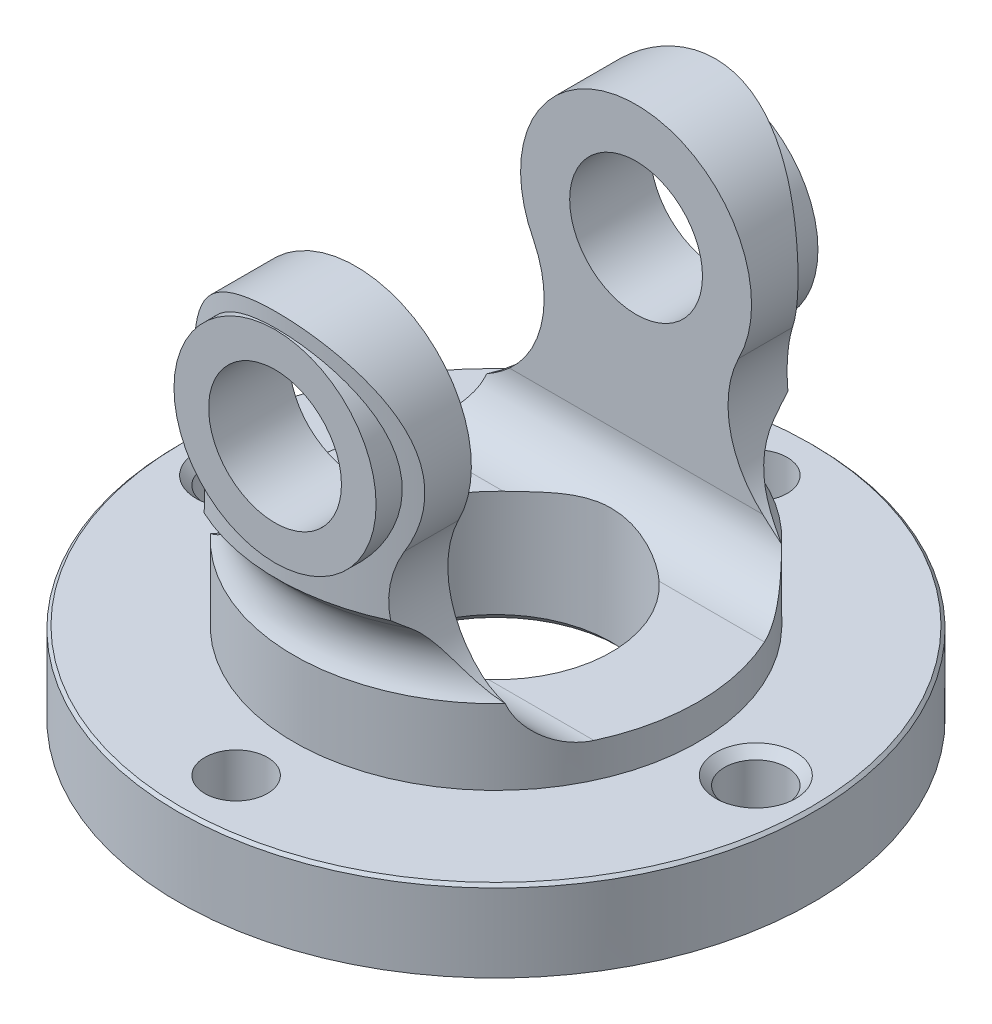
from build123d import *

# Parameters (mm, degrees)
CUT_EXTRUDE3_DEPTH      = 112.579568022
CUT_EXTRUDE3_DEPTH_BACK = 112.579568022
SKETCH2_W               = 15
SKETCH2_H               = 48
CUT_EXTRUDE4_DEPTH      = 112.579568022
CUT_EXTRUDE4_DEPTH_BACK = 112.579568022
SKETCH3_W               = 48.522720568
SKETCH3_H               = 48
FILLET1_R               = 8
DELETEFACE1_START       = 26.9999999
DELETEFACE1_DEPTH       = 53.0000001
SKETCH4_R               = 17.5
SKETCH4_R_2             = 11.5
BOSS_EXTRUDE1_DEPTH     = 14
CUT_EXTRUDE5_DEPTH      = 112.579568094
CUT_EXTRUDE5_DEPTH_BACK = 112.579568094
SKETCH5_R               = 11.5
FILLET3_R               = 20
CUT_EXTRUDE6_DEPTH      = 103.009803515
CUT_EXTRUDE6_DEPTH_BACK = 103.009803515
SKETCH8_R               = 5.425
CHAMFER1_SIZE           = 1.5
CHAMFER2_SIZE           = 0.5
CUT_EXTRUDE7_DEPTH      = 112.579568094
CUT_EXTRUDE7_DEPTH_BACK = 112.579568094
CUT_EXTRUDE8_DEPTH      = 112.579568094
CUT_EXTRUDE8_DEPTH_BACK = 112.579568094


with BuildPart() as part:
    # Sketch1 → Revolve1 (revolve)
    with BuildSketch(Plane.XY, mode=Mode.PRIVATE) as revolve1_sk:
        Polygon((20, 0), (55, 0), (55, 14), (35, 14), (35, 27), (30, 32), (38, 40), (38, 80), (30, 80), (30, 40), (20, 30), (20, 14), align=None)
    revolve(revolve1_sk.sketch.rotate(Axis((0, 0, 0), (0, 1, 0)), 90), axis=Axis((0, 0, 0), (0, 1, 0)))

    # Sketch2 → Cut-Extrude3 (cut, two sides: drawn at the far end of the back side and taken through both)
    with BuildSketch(Plane.XY.offset(-CUT_EXTRUDE3_DEPTH_BACK)):
        with Locations((-30.5, 56)):
            Rectangle(SKETCH2_W, SKETCH2_H)
        with Locations((30.5, 56)):
            Rectangle(SKETCH2_W, SKETCH2_H)
    extrude(amount=CUT_EXTRUDE3_DEPTH + CUT_EXTRUDE3_DEPTH_BACK, mode=Mode.SUBTRACT)

    # Sketch3 → Cut-Extrude4 (cut, two sides: drawn at the far end of the back side and taken through both)
    with BuildSketch(Plane(origin=(0, 0, 0), x_dir=(0, 0, -1), z_dir=(1, 0, 0)).offset(-CUT_EXTRUDE4_DEPTH_BACK)):
        with Locations((0, 56)):
            Rectangle(SKETCH3_W, SKETCH3_H)
    extrude(amount=CUT_EXTRUDE4_DEPTH + CUT_EXTRUDE4_DEPTH_BACK, mode=Mode.SUBTRACT)

    # Fillet1
    # the kernel refuses this fillet: 8 mm, written as the material it adds along each edge
    with BuildSketch(Plane(origin=(0, 32, 0), x_dir=(-0.961157197815047, 0, 0.2760015237065304), z_dir=(-0.2760015237065304, 0, -0.961157197815047))) as fillet1_piece_1_section:
        with BuildLine():
            CenterArc((41.275443262, -0.038265237), FILLET1_R, 135, 83.331971404)
            Line((35.618589013, 5.618589013), (30, 0))
            Line((30, 0), (35, -5))
        make_face()
    fillet1_piece_1 = revolve(axis=Axis((0, 32, 0), (0, 1, 0)), revolution_arc=147.956585356, mode=Mode.PRIVATE)
    fillet1_piece_1 = split(fillet1_piece_1, bisect_by=Plane(origin=(0, 32, 24.261360284), z_dir=(0, 0, 1)), keep=Keep.TOP, mode=Mode.PRIVATE)
    fillet1_piece_1 = split(fillet1_piece_1, bisect_by=Plane(origin=(0, 32, 0), z_dir=(0, -1, 0)), keep=Keep.TOP, mode=Mode.PRIVATE)
    add(fillet1_piece_1)
    with BuildSketch(Plane(origin=(0, 32, 0), x_dir=(-0.961157197815047, 0, 0.2760015237065304), z_dir=(-0.2760015237065304, 0, -0.961157197815047))) as fillet1_piece_2_section:
        with BuildLine():
            CenterArc((41.275443262, -0.038265237), FILLET1_R, 135, 83.331971404)
            Line((35.618589013, 5.618589013), (30, 0))
            Line((30, 0), (35, -5))
        make_face()
    fillet1_piece_2 = revolve(axis=Axis((0, 32, 0), (0, 1, 0)), revolution_arc=147.956585356, mode=Mode.PRIVATE)
    fillet1_piece_2 = split(fillet1_piece_2, bisect_by=Plane(origin=(-23, 32, 0), z_dir=(1, 0, 0)), keep=Keep.TOP, mode=Mode.PRIVATE)
    fillet1_piece_2 = split(fillet1_piece_2, bisect_by=Plane(origin=(0, 32, 24.261360284), z_dir=(0, 0, 1)), keep=Keep.TOP, mode=Mode.PRIVATE)
    fillet1_piece_2 = split(fillet1_piece_2, bisect_by=Plane(origin=(23, 32, 0), z_dir=(-1, 0, 0)), keep=Keep.TOP, mode=Mode.PRIVATE)
    add(fillet1_piece_2)
    with BuildSketch(Plane(origin=(0, 32, 0), x_dir=(0, 0, -1), z_dir=(1, 0, 0))) as fillet1_piece_3_section:
        with BuildLine():
            CenterArc((41.275443262, -0.038265237), FILLET1_R, 135, 83.331971404)
            Line((35.618589013, 5.618589013), (30, 0))
            Line((30, 0), (35, -5))
        make_face()
    fillet1_piece_3 = revolve(axis=Axis((0, 32, 0), (0, 1, 0)), revolution_arc=73.970965647, mode=Mode.PRIVATE)
    fillet1_piece_3 = split(fillet1_piece_3, bisect_by=Plane(origin=(0, 32, -24.261360284), z_dir=(0, 0, -1)), keep=Keep.TOP, mode=Mode.PRIVATE)
    fillet1_piece_3 = split(fillet1_piece_3, bisect_by=Plane(origin=(-23, 32, 0), z_dir=(1, 0, 0)), keep=Keep.TOP, mode=Mode.PRIVATE)
    add(fillet1_piece_3)
    with BuildSketch(Plane(origin=(0, 32, 0), x_dir=(0, 0, -1), z_dir=(1, 0, 0))) as fillet1_piece_4_section:
        with BuildLine():
            CenterArc((41.275443262, -0.038265237), FILLET1_R, 135, 83.331971404)
            Line((35.618589013, 5.618589013), (30, 0))
            Line((30, 0), (35, -5))
        make_face()
    fillet1_piece_4 = revolve(axis=Axis((0, 32, 0), (0, 1, 0)), revolution_arc=73.970965647, mode=Mode.PRIVATE)
    fillet1_piece_4 = split(fillet1_piece_4, bisect_by=Plane(origin=(0, 32, 0), z_dir=(0, -1, 0)), keep=Keep.TOP, mode=Mode.PRIVATE)
    fillet1_piece_4 = split(fillet1_piece_4, bisect_by=Plane(origin=(0, 32, -24.261360284), z_dir=(0, 0, -1)), keep=Keep.TOP, mode=Mode.PRIVATE)
    add(fillet1_piece_4)
    with BuildSketch(Plane(origin=(0, 32, 0), x_dir=(0.9611218946578147, 0, -0.2761244350096031), z_dir=(0.2761244350096031, 0, 0.9611218946578147))) as fillet1_piece_5_section:
        with BuildLine():
            CenterArc((41.275443262, -0.038265237), FILLET1_R, 135, 83.331971404)
            Line((35.618589013, 5.618589013), (30, 0))
            Line((30, 0), (35, -5))
        make_face()
    fillet1_piece_5 = revolve(axis=Axis((0, 32, 0), (0, 1, 0)), revolution_arc=73.970965647, mode=Mode.PRIVATE)
    fillet1_piece_5 = split(fillet1_piece_5, bisect_by=Plane(origin=(0, 32, 0), z_dir=(0, -1, 0)), keep=Keep.TOP, mode=Mode.PRIVATE)
    fillet1_piece_5 = split(fillet1_piece_5, bisect_by=Plane(origin=(0, 32, -24.261360284), z_dir=(0, 0, -1)), keep=Keep.TOP, mode=Mode.PRIVATE)
    add(fillet1_piece_5)
    with BuildSketch(Plane(origin=(0, 32, 0), x_dir=(0.9611218946578147, 0, -0.2761244350096031), z_dir=(0.2761244350096031, 0, 0.9611218946578147))) as fillet1_piece_6_section:
        with BuildLine():
            CenterArc((41.275443262, -0.038265237), FILLET1_R, 135, 83.331971404)
            Line((35.618589013, 5.618589013), (30, 0))
            Line((30, 0), (35, -5))
        make_face()
    fillet1_piece_6 = revolve(axis=Axis((0, 32, 0), (0, 1, 0)), revolution_arc=73.970965647, mode=Mode.PRIVATE)
    fillet1_piece_6 = split(fillet1_piece_6, bisect_by=Plane(origin=(0, 32, -24.261360284), z_dir=(0, 0, -1)), keep=Keep.TOP, mode=Mode.PRIVATE)
    fillet1_piece_6 = split(fillet1_piece_6, bisect_by=Plane(origin=(23, 32, 0), z_dir=(-1, 0, 0)), keep=Keep.TOP, mode=Mode.PRIVATE)
    add(fillet1_piece_6)

    # DeleteFace1: read off the stored shape, not the designer's step
    # DeleteFace1 outline → DeleteFace1 (add)
    with BuildSketch(Plane(origin=(0, 0, 0), x_dir=(1, 0, 0), z_dir=(0, 1, 0)).offset(DELETEFACE1_START)):
        with BuildLine():
            Line((-17.646143974, 24.261360284), (17.646143974, 24.261360284))
            ThreePointArc((17.646143974, 24.261360284), (0, 30), (-17.646143974, 24.261360284))
        make_face()
        with BuildLine():
            Line((17.646143974, -24.261360284), (-17.646143974, -24.261360284))
            ThreePointArc((-17.646143974, -24.261360284), (0, -30), (17.646143974, -24.261360284))
        make_face()
    extrude(amount=DELETEFACE1_DEPTH)

    # Sketch4 → Boss-Extrude1 (add)
    with BuildSketch(Plane.XY.offset(-24.261360284)):
        with Locations((0, 60)):
            Circle(SKETCH4_R)
        with Locations((0, 60)):
            Circle(SKETCH4_R_2, mode=Mode.SUBTRACT)
    boss_extrude1 = extrude(amount=-BOSS_EXTRUDE1_DEPTH)

    # Mirror1: Boss-Extrude1 across plane
    add(boss_extrude1.mirror(Plane.XY))

    # Sketch5 → Cut-Extrude5 (cut, two sides: drawn at the far end of the back side and taken through both)
    with BuildSketch(Plane.XY.offset(-CUT_EXTRUDE5_DEPTH_BACK)):
        with Locations((0, 60)):
            Circle(SKETCH5_R)
    extrude(amount=CUT_EXTRUDE5_DEPTH + CUT_EXTRUDE5_DEPTH_BACK, mode=Mode.SUBTRACT)

    # Fillet3
    fillet3_edges = [part.edges().sort_by_distance(p)[0] for p in [
        (-23, 80, -27.255163604),
        (23, 80, -27.255163604),
        (-23, 80, 27.255163604),
        (23, 80, 27.255163604),
    ]]
    fillet(fillet3_edges, radius=FILLET3_R)

    # Sketch7 → Revolve3 (revolve)
    with BuildSketch(Plane(origin=(0, 0, 0), x_dir=(0, 0, -1), z_dir=(1, 0, 0)), mode=Mode.PRIVATE) as revolve3_sk:
        with BuildLine():
            Line((-22.395862352, 27), (-22.395862352, 32))
            Line((-22.395862352, 32), (-33.275534777, 32))
            ThreePointArc((-33.275534777, 32), (-33.712611988, 29.35336686), (-35, 27))
            Line((-35, 27), (-22.395862352, 27))
        make_face()
    revolve(revolve3_sk.sketch.rotate(Axis((0, 0, 0), (0, 1, 0)), 180), axis=Axis((0, 0, 0), (0, 1, 0)))

    # Sketch8 → Cut-Extrude6 (cut, two sides: drawn at the far end of the back side and taken through both)
    with BuildSketch(Plane(origin=(0, 14, 0), x_dir=(1, 0, 0), z_dir=(0, 1, 0)).offset(-CUT_EXTRUDE6_DEPTH_BACK)):
        with Locations(Location((0, 45, 0), (0, 0, 270))):
            Circle(SKETCH8_R)
        with Locations(Location((45, 0, 0), (0, 0, 270))):
            Circle(SKETCH8_R)
        with Locations(Location((0, -45, 0), (0, 0, 270))):
            Circle(SKETCH8_R)
        with Locations(Location((-45, 0, 0), (0, 0, 270))):
            Circle(SKETCH8_R)
    extrude(amount=CUT_EXTRUDE6_DEPTH + CUT_EXTRUDE6_DEPTH_BACK, mode=Mode.SUBTRACT)

    # Chamfer1
    chamfer1_edges = [part.edges().sort_by_distance(p)[0] for p in [
        (0, 0, 20),
        (0, 0, -50.425),
        (45, 14, -5.425),
        (45, 0, -5.425),
        (0, 0, 39.575),
        (-45, 14, -5.425),
        (-45, 0, -5.425),
    ]]
    chamfer(chamfer1_edges, length=CHAMFER1_SIZE)

    # Chamfer2
    chamfer2_edges = [part.edges().sort_by_distance(p)[0] for p in [
        (0, 14, 55),
    ]]
    chamfer(chamfer2_edges, length=CHAMFER2_SIZE)

    # Sketch9 → Cut-Extrude7 (cut, two sides: drawn at the far end of the back side and taken through both)
    with BuildSketch(Plane(origin=(0, 0, 0), x_dir=(0, 0, -1), z_dir=(1, 0, 0)).offset(-CUT_EXTRUDE7_DEPTH_BACK)):
        with BuildLine():
            Line((-24.261360284, 32), (24.261360284, 32))
            Line((24.261360284, 32), (24.261360284, 29.5))
            ThreePointArc((24.261360284, 29.5), (21.478874706, 22.782485579), (14.761360284, 20))
            Line((14.761360284, 20), (-14.761360284, 20))
            ThreePointArc((-14.761360284, 20), (-21.478874706, 22.782485579), (-24.261360284, 29.5))
            Line((-24.261360284, 29.5), (-24.261360284, 32))
        make_face()
    extrude(amount=CUT_EXTRUDE7_DEPTH + CUT_EXTRUDE7_DEPTH_BACK, mode=Mode.SUBTRACT)

    # Sketch11 → Cut-Extrude8 (cut, two sides: drawn at the far end of the back side and taken through both)
    with BuildSketch(Plane.XY.offset(-CUT_EXTRUDE8_DEPTH_BACK)):
        with BuildLine():
            Line((-25.544510939, 27), (-25.544510939, 88.521994175))
            Line((-25.544510939, 88.521994175), (25.544510939, 88.521994175))
            Line((25.544510939, 88.521994175), (25.544510939, 27))
            ThreePointArc((25.544510939, 27), (16.817478375, 37.293213059), (17.735923741, 50.756785784))
            ThreePointArc((17.735923741, 50.756785784), (0, 80), (-17.735923741, 50.756785784))
            ThreePointArc((-17.735923741, 50.756785784), (-16.817478375, 37.293213059), (-25.544510939, 27))
        make_face()
    extrude(amount=CUT_EXTRUDE8_DEPTH + CUT_EXTRUDE8_DEPTH_BACK, mode=Mode.SUBTRACT)


solid = part.part
